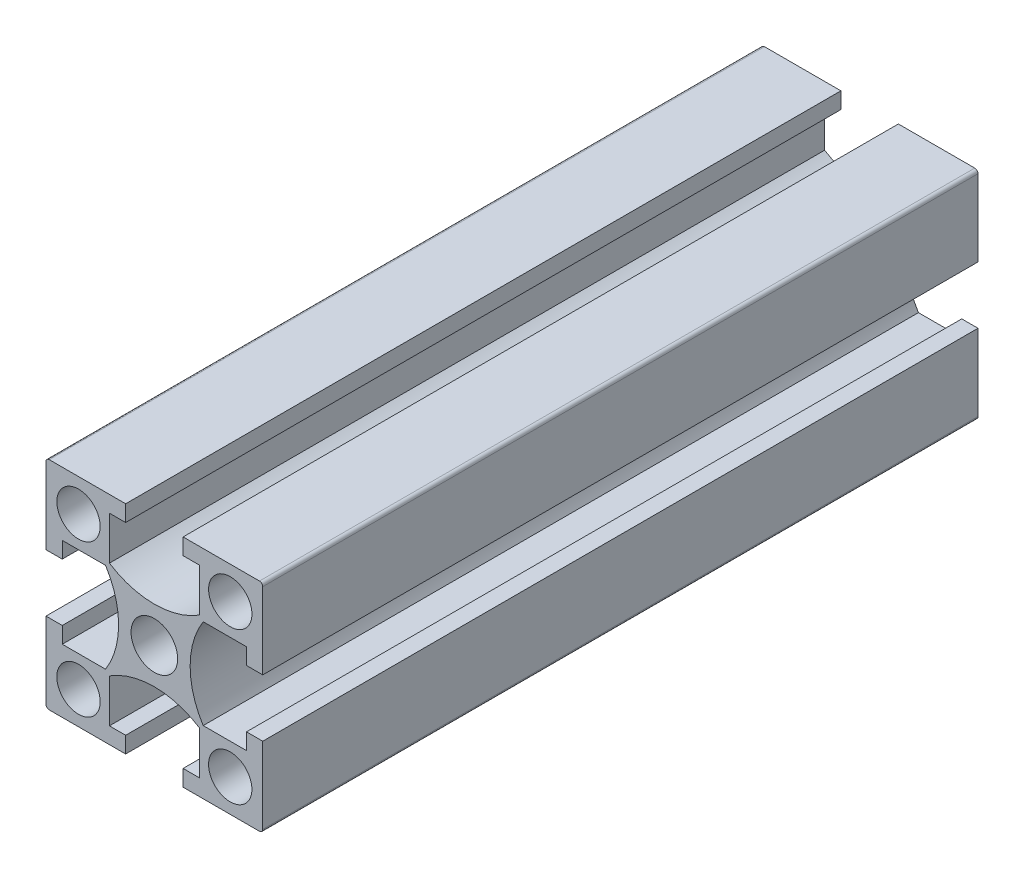
from build123d import *

# Parameters (mm, degrees)
SKETCH_1_W               = 20
SKETCH_1_H               = 20
SKETCH_1_R               = 2
SKETCH_1_R_2             = 2.15
EXTRUDE_1_DEPTH          = 66
CUT_EXTRUDE_1_REACH      = 69.498
PATTERN_CIRCULAR_1_COUNT = 4
FILLET_1_R               = 0.3
SKETCH_3_R               = 2.15
SKETCH_3_R_2             = 2.5
CUT_EXTRUDE_2_DEPTH      = 70.685005561
SKETCH_4_R               = 2.5
CUT_EXTRUDE_3_DEPTH      = 70.685005655


with BuildPart() as part:
    # 스케치1 → 보스-돌출1 (new body)
    with BuildSketch(Plane.XY):
        Rectangle(SKETCH_1_W, SKETCH_1_H)
        with Locations((-7, -7)):
            Circle(SKETCH_1_R, mode=Mode.SUBTRACT)
        with Locations((7, -7)):
            Circle(SKETCH_1_R, mode=Mode.SUBTRACT)
        with Locations((-7, 7)):
            Circle(SKETCH_1_R, mode=Mode.SUBTRACT)
        Circle(SKETCH_1_R_2, mode=Mode.SUBTRACT)
        with Locations((7, 7)):
            Circle(SKETCH_1_R, mode=Mode.SUBTRACT)
    extrude(amount=EXTRUDE_1_DEPTH)

    # 스케치1<3> → 컷-돌출1 (cut, up to next)
    with BuildSketch(Plane.XY, mode=Mode.PRIVATE) as cut_extrude_1_sk1:
        with BuildLine():
            Line((-8.5, 2.65), (-10, 2.65))
            Line((-10, 2.65), (-10, -2.65))
            Line((-10, -2.65), (-8.5, -2.65))
            Line((-8.5, -2.65), (-8.5, -4.15))
            Line((-8.5, -4.15), (-4.503166667, -4.15))
            ThreePointArc((-4.503166667, -4.15), (-3.3, 0), (-4.503166667, 4.15))
            Line((-4.503166667, 4.15), (-8.5, 4.15))
            Line((-8.5, 4.15), (-8.5, 2.65))
        make_face()
    cut_extrude_1_tool1 = extrude(cut_extrude_1_sk1.sketch, amount=CUT_EXTRUDE_1_REACH, mode=Mode.PRIVATE) & part.part
    cut_extrude_1 = cut_extrude_1_tool1.solids().sort_by_distance((-6.606913, 0, 0))[0]
    add(cut_extrude_1, mode=Mode.SUBTRACT)

    # 원형 패턴1: 컷-돌출1 ×4 about axis
    pattern_circular_1_axis = Axis((0, 0, 66), (0, 0, -1))
    for i in range(1, PATTERN_CIRCULAR_1_COUNT):
        add(cut_extrude_1.rotate(pattern_circular_1_axis, i * 360 / PATTERN_CIRCULAR_1_COUNT), mode=Mode.SUBTRACT)

    # 필렛1
    fillet_1_edges = [part.edges().sort_by_distance(p)[0] for p in [
        (10, -10, 33),
        (-10, -10, 33),
        (-10, 10, 33),
        (10, 10, 33),
    ]]
    fillet(fillet_1_edges, radius=FILLET_1_R)

    # 스케치3 → 컷-돌출2 (cut, through all)
    with BuildSketch(Plane(origin=(0, 10, 0), x_dir=(1, 0, 0), z_dir=(0, 1, 0))):
        with Locations((0, -10)):
            Circle(SKETCH_3_R)
        with Locations((0, -55)):
            Circle(SKETCH_3_R_2)
    extrude(amount=-CUT_EXTRUDE_2_DEPTH, mode=Mode.SUBTRACT)

    # 스케치4 → 컷-돌출3 (cut, through all)
    with BuildSketch(Plane(origin=(0, 10, 0), x_dir=(1, 0, 0), z_dir=(0, 1, 0))):
        with Locations((0, -19)):
            Circle(SKETCH_4_R)
    extrude(amount=-CUT_EXTRUDE_3_DEPTH, mode=Mode.SUBTRACT)


solid = part.part
